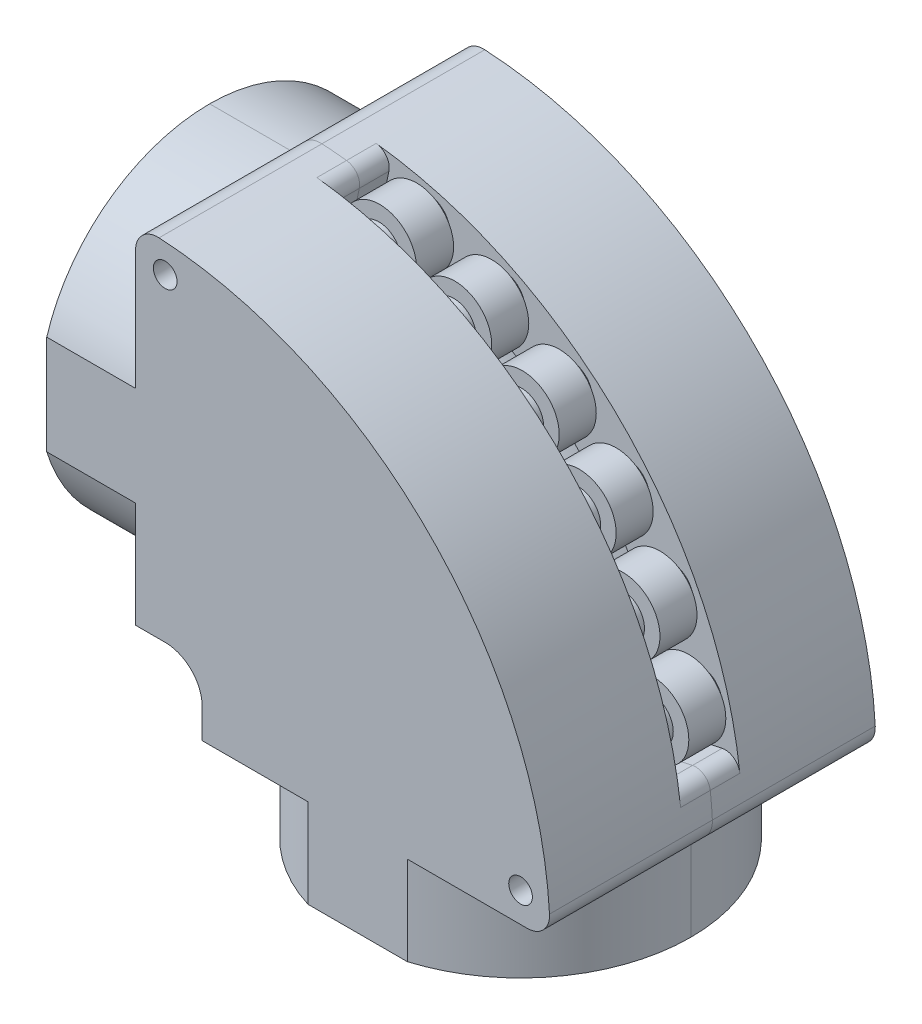
from build123d import *

# Parameters (mm, degrees)
EXTRUDE_1_DEPTH              = 11
SWEEP_1_PROFILE_R            = 9
SKETCH_20_W                  = 22
SKETCH_20_H                  = 26.000000000000004
SKETCH_20_R                  = 9.000000000000004
EXTRUDE_2_DEPTH              = 3
SKETCH_21_W                  = 26.000000000000004
SKETCH_21_H                  = 22
SKETCH_21_R                  = 9.000000000000004
EXTRUDE_3_DEPTH              = 3
SKETCH_22_R                  = 11.500000000000004
SKETCH_22_R_2                = 9.000000000000004
EXTRUDE_4_DEPTH              = 3
SKETCH_23_R                  = 11.500000000000005
SKETCH_23_R_2                = 9.000000000000004
EXTRUDE_5_DEPTH              = 3
SKETCH_25_R                  = 0.9900000000000011
SKETCH_25_R_2                = 0.9900000000000015
SKETCH_25_R_3                = 0.9899999999999978
SKETCH_25_R_4                = 0.9899999999999924
CUT_EXTRUDE_2_DEPTH          = 2
FILLET_1_R                   = 1
SKETCH_26_R                  = 1.5000000000000009
SKETCH_26_R_2                = 1.5000000000000007
EXTRUDE_6_DEPTH              = 0.7
EXTRUDE_7_DEPTH              = 11
CUT_EXTRUDE_3_DEPTH          = 6
SKETCH_24_R                  = 0.6999999999999982
SKETCH_24_R_2                = 0.699999999999998
SKETCH_24_R_3                = 0.7000000000000001
CUT_EXTRUDE_4_DEPTH          = 20.000000000000004
CUT_EXTRUDE_START            = -3
CUT_EXTRUDE_5_DEPTH          = 3
CUT_EXTRUDE_6_DEPTH          = 3
SKETCH_32_R                  = 10.04
CUT_EXTRUDE_7_DEPTH          = 4
SKETCH_33_R                  = 10.040000000000003
CUT_EXTRUDE_8_DEPTH          = 4
CUT_EXTRUDE_9_DEPTH          = 4
CUT_EXTRUDE_10_DEPTH         = 4
FILLET_2_R                   = 1.5
CHAMFER_1_SIZE               = 0.3
HOLE_START                   = -5
HOLE_WIZARD_M2_1_OUTLINE_R   = 0.8
HOLE_WIZARD_M2_1_OUTLINE_R_2 = 0.7
HOLE_WIZARD_M2_1_DEPTH       = 5
SKETCH_40_R                  = 1.0500000000000003
CUT_EXTRUDE_13_DEPTH         = 5
SKETCH_41_R                  = 2.4999999999999996
SKETCH_41_R_2                = 1
EXTRUDE_8_DEPTH              = 1.25
SKETCH_41_R_3                = 1.0000000000000018
EXTRUDE_8_2_DEPTH            = 1.25
SKETCH_41_R_4                = 2.4999999999999982
EXTRUDE_8_3_DEPTH            = 1.25
EXTRUDE_8_4_DEPTH            = 1.25
SKETCH_41_R_5                = 2.4999999999999987
EXTRUDE_8_5_DEPTH            = 1.25
SKETCH_41_R_6                = 1.0000000000000013
EXTRUDE_8_6_DEPTH            = 1.25
FILLET_5_R                   = 1.5
FILLET_6_R                   = 1.5
CHAMFER_2_SIZE               = 0.3
CHAMFER_3_SIZE               = 0.3


# Read off the part's stored shape, not the designer's step: M2 螺纹孔1
with BuildPart() as part:
    # 草图1 → 凸台-拉伸1 (new, symmetric)
    with BuildSketch(Plane.XY):
        with BuildLine():
            Line((0, 2), (0, 28))
            ThreePointArc((0, 28), (19.79898987322333, 19.798989873223327), (28, 0))
            Line((28, 0), (2, 0))
            ThreePointArc((2, 0), (1.4142135623730951, 1.414213562373095), (0, 2))
        make_face()
    extrude(amount=EXTRUDE_1_DEPTH, both=True)

    # 切除-扫描1: sweep along a path in 草图2
    with BuildLine(Plane.XY) as sweep_1_path:
        CenterArc((0, 0), 15, 0, 360)
    # 切除-扫描1 profile (on start of the path) → 切除-扫描1 (sweep, cut)
    with BuildSketch(Plane(origin=(15, 0, 0), x_dir=(0, 0, 1), z_dir=(0, 1, 0))):
        Circle(SWEEP_1_PROFILE_R)
    sweep(path=sweep_1_path.line, mode=Mode.SUBTRACT)

    # 草图20 → 凸台-拉伸2 (add)
    with BuildSketch(Plane.ZY):
        with Locations((0, 15.000000000000002)):
            Rectangle(SKETCH_20_W, SKETCH_20_H)
        with Locations(Location((0, 15, 0), (0, 0, 90))):
            Circle(SKETCH_20_R, mode=Mode.SUBTRACT)
    extrude(amount=EXTRUDE_2_DEPTH)

    # 草图21 → 凸台-拉伸3 (add)
    with BuildSketch(Plane.XZ):
        with Locations((15.000000000000002, 0)):
            Rectangle(SKETCH_21_W, SKETCH_21_H)
        with Locations((15, 0)):
            Circle(SKETCH_21_R, mode=Mode.SUBTRACT)
    extrude(amount=EXTRUDE_3_DEPTH)

    # 草图22 → 凸台-拉伸4 (add)
    with BuildSketch(Plane.ZY.offset(3)):
        with Locations(Location((0, 15, 0), (0, 0, 163.042573706))):
            Circle(SKETCH_22_R)
        with Locations(Location((0, 15, 0), (0, 0, 90))):
            Circle(SKETCH_22_R_2, mode=Mode.SUBTRACT)
    extrude(amount=EXTRUDE_4_DEPTH)

    # 草图23 → 凸台-拉伸5 (add)
    with BuildSketch(Plane.XZ.offset(3)):
        with Locations(Location((15, 0, 0), (0, 0, 73.042573706))):
            Circle(SKETCH_23_R)
        with Locations((15, 0)):
            Circle(SKETCH_23_R_2, mode=Mode.SUBTRACT)
    extrude(amount=EXTRUDE_5_DEPTH)


with BuildPart() as body_2:
    # Split Bodies 1: the piece on the far side of the plane
    add(part.part)
    split(bisect_by=Plane.XY, keep=Keep.BOTTOM)

    # 草图25 → 切除-拉伸2 (cut)
    with BuildSketch(Plane.XY):
        with BuildLine():
            Line((4.330809913065054, 27.663045484850322), (3.509435736738149, 23.742027310440555))
            Line((3.509435736738149, 23.742027310440555), (2.768666432993156, 20.205794997881245))
            Line((2.768666432993156, 20.205794997881245), (18.79288362531123, 2.4726900148164406))
            Line((18.79288362531123, 2.4726900148164406), (23.74202731044055, 3.50943573673818))
            Line((23.74202731044055, 3.50943573673818), (27.66304548485032, 4.3308099130650675))
            ThreePointArc((27.66304548485032, 4.3308099130650675), (19.798989873223327, 19.798989873223338), (4.330809913065054, 27.663045484850322))
        make_face()
        with Locations((20.20579499788125, 16.362330167295774)):
            Circle(SKETCH_25_R, mode=Mode.SUBTRACT)
        with Locations((23.166169628897574, 11.803752993228205)):
            Circle(SKETCH_25_R_2, mode=Mode.SUBTRACT)
        with Locations((25.114071483515783, 6.729295172665515)):
            Circle(SKETCH_25_R_2, mode=Mode.SUBTRACT)
        with Locations(Location((6.72929517266551, 25.11407148351578, 0), (0, 0, 180))):
            Circle(SKETCH_25_R, mode=Mode.SUBTRACT)
        with Locations(Location((11.803752993228201, 23.16616962889757, 0), (0, 0, 180))):
            Circle(SKETCH_25_R_3, mode=Mode.SUBTRACT)
        with Locations(Location((16.36233016729577, 20.205794997881245, 0), (0, 0, 180))):
            Circle(SKETCH_25_R_4, mode=Mode.SUBTRACT)
    extrude(amount=-CUT_EXTRUDE_2_DEPTH, mode=Mode.SUBTRACT)

    # 圆角1
    fillet_1_edges = [body_2.edges().sort_by_distance(p)[0] for p in [
        (23.68668897770624, 3.4978434728293823, -1.006332760110998),
        (3.497843472828735, 23.6866889777033, -1.0063327601106522),
        (27.663045484850322, 4.3308099130650675, -1),
        (4.330809913065055, 27.663045484850326, -1),
    ]]
    fillet(fillet_1_edges, radius=FILLET_1_R)

    # 草图26 → 凸台-拉伸6 (add)
    with BuildSketch(Plane.XY.offset(-2)):
        with Locations((6.72929517266551, 25.11407148351578)):
            Circle(SKETCH_26_R)
        with Locations((11.803752993228201, 23.16616962889757)):
            Circle(SKETCH_26_R)
        with Locations((16.36233016729577, 20.205794997881245)):
            Circle(SKETCH_26_R)
        with Locations((20.20579499788125, 16.362330167295774)):
            Circle(SKETCH_26_R)
        with Locations((23.166169628897574, 11.803752993228205)):
            Circle(SKETCH_26_R)
        with Locations((25.114071483515783, 6.729295172665515)):
            Circle(SKETCH_26_R_2)
    extrude(amount=EXTRUDE_6_DEPTH)

    # 草图27 → 凸台-拉伸7 (add)
    with BuildSketch(Plane.XY):
        with BuildLine():
            Line((0, 2), (0, 0))
            Line((0, 0), (2, 0))
            ThreePointArc((2, 0), (1.4142135623730951, 1.414213562373095), (0, 2))
        make_face()
    extrude(amount=-EXTRUDE_7_DEPTH)

    # 草图28 → 切除-拉伸3 (cut)
    with BuildSketch(Plane(origin=(0, 0, -11), x_dir=(-1, 0, 0), z_dir=(0, 0, -1))):
        with BuildLine():
            Line((-4.5, 1.9999999999999982), (-4.500000000000001, -3))
            Line((-4.500000000000001, -3), (3, -3))
            Line((3, -3), (3, 4.499999999999999))
            Line((3, 4.499999999999999), (-2.0000000000000004, 4.499999999999999))
            ThreePointArc((-2.0000000000000004, 4.499999999999999), (-3.767766952966369, 3.767766952966368), (-4.5, 1.9999999999999982))
        make_face()
    extrude(amount=-CUT_EXTRUDE_3_DEPTH, mode=Mode.SUBTRACT)

    # 草图24 → 切除-拉伸4 (cut)
    with BuildSketch(Plane.XY):
        with Locations((2, 26)):
            Circle(SKETCH_24_R)
        with Locations((25.999999999999996, 2.0000000000000018)):
            Circle(SKETCH_24_R_2)
        with Locations((2, 1.9999999999999987)):
            Circle(SKETCH_24_R_3)
    extrude(amount=-CUT_EXTRUDE_4_DEPTH, mode=Mode.SUBTRACT)

    # 草图30 → 切除-拉伸5 (cut)
    with BuildSketch(Plane.ZY.offset(3).offset(CUT_EXTRUDE_START)):
        with BuildLine():
            ThreePointArc((-11, 18.3541019662497), (-6.843896090244526, 24.2418118519009), (7e-16, 26.500000000000007))
            Line((7e-16, 26.500000000000004), (0, 28))
            Line((0, 28), (-11, 28))
            Line((-11, 28), (-10.999999999999998, 18.3541019662497))
        make_face()
        with BuildLine():
            ThreePointArc((8.9e-16, 3.4999999999999947), (-6.843896090244344, 5.758188148098972), (-10.99999999999987, 11.645898033749877))
            Line((-10.999999999999998, 11.645898033749859), (-11, 4.5))
            Line((-11, 4.499999999999999), (-4.999999999999999, 4.499999999999999))
            Line((-4.999999999999999, 4.499999999999999), (-4.999999999999999, 1.9999999999999982))
            Line((-4.999999999999999, 1.9999999999999982), (0, 2))
            Line((0, 2), (0, 3.4999999999999942))
        make_face()
        with BuildLine():
            Line((-10.999999999999998, 11.645898033749859), (-10.999999999999998, 18.3541019662497))
            ThreePointArc((-11, 18.3541019662497), (-11.500000000000004, 14.99999999999978), (-10.99999999999987, 11.645898033749877))
        make_face()
    extrude(amount=CUT_EXTRUDE_5_DEPTH, mode=Mode.SUBTRACT)

    # 草图31 → 切除-拉伸6 (cut)
    with BuildSketch(Plane.XZ.offset(3).offset(CUT_EXTRUDE_START)):
        with BuildLine():
            Line((28, -11), (28, 0))
            Line((28, 0), (26.500000000000004, 0))
            ThreePointArc((26.500000000000004, 0), (24.2418118519009, -6.843896090244522), (18.354101966249704, -11))
            Line((18.354101966249704, -11), (28, -11))
        make_face()
        with BuildLine():
            Line((4.500000000000001, -4.999999999999999), (4.500000000000001, -11))
            Line((4.500000000000001, -11), (11.645898033750294, -11))
            ThreePointArc((11.645898033750294, -11), (5.758188148099103, -6.84389609024452), (3.4999999999999942, 0))
            Line((3.4999999999999942, 0), (2, 0))
            Line((2, 0), (2.000000000000001, -4.999999999999999))
            Line((2.000000000000001, -4.999999999999999), (4.500000000000001, -4.999999999999999))
        make_face()
    extrude(amount=CUT_EXTRUDE_6_DEPTH, mode=Mode.SUBTRACT)

    # 草图32 → 切除-拉伸7 (cut)
    with BuildSketch(Plane.ZY.offset(6)):
        with Locations((0, 15)):
            Circle(SKETCH_32_R)
    extrude(amount=-CUT_EXTRUDE_7_DEPTH, mode=Mode.SUBTRACT)

    # 草图33 → 切除-拉伸8 (cut)
    with BuildSketch(Plane.XZ.offset(6)):
        with Locations((15, 0)):
            Circle(SKETCH_33_R)
    extrude(amount=-CUT_EXTRUDE_8_DEPTH, mode=Mode.SUBTRACT)

    # 草图34 → 切除-拉伸9 (cut)
    with BuildSketch(Plane(origin=(0, -3, 0), x_dir=(1, 0, 0), z_dir=(0, 1, 0))):
        with BuildLine():
            Line((11.645898033750296, 11), (18.354101966249704, 11))
            ThreePointArc((18.354101966249704, 11), (15, 11.500000000000005), (11.645898033750296, 11))
        make_face()
    extrude(amount=-CUT_EXTRUDE_9_DEPTH, mode=Mode.SUBTRACT)

    # 草图35 → 切除-拉伸10 (cut)
    with BuildSketch(Plane(origin=(-3, 0, 0), x_dir=(0, 0, -1), z_dir=(1, 0, 0))):
        with BuildLine():
            Line((10.999999999999998, 18.354101966249704), (10.999999999999996, 11.645898033750292))
            ThreePointArc((10.999999999999996, 11.645898033750292), (11.500000000000004, 14.999999999999998), (10.999999999999998, 18.354101966249704))
        make_face()
    extrude(amount=-CUT_EXTRUDE_10_DEPTH, mode=Mode.SUBTRACT)

    # 圆角2
    fillet_2_edges = [body_2.edges().sort_by_distance(p)[0] for p in [
        (0, 0, -2.5),
    ]]
    fillet(fillet_2_edges, radius=FILLET_2_R)

    # 倒角1
    chamfer_1_edges = [body_2.edges().sort_by_distance(p)[0] for p in [
        (-6, 15.000000000000002, -10.04),
    ]]
    chamfer(chamfer_1_edges, length=CHAMFER_1_SIZE)

    # M2 螺纹孔1 outline → M2 螺纹孔1 (cut)
    with BuildSketch(Plane.XY.offset(HOLE_START)):
        with Locations((2, 2)):
            Circle(HOLE_WIZARD_M2_1_OUTLINE_R)
        with Locations((2, 2)):
            Circle(HOLE_WIZARD_M2_1_OUTLINE_R_2, mode=Mode.SUBTRACT)
    extrude(amount=HOLE_WIZARD_M2_1_DEPTH, mode=Mode.SUBTRACT)

    # Hole Wizard M2 _1 2 outline → Hole Wizard M2 _1 2 (revolve, cut)
    with BuildSketch(Plane(origin=(26, 2, 0), x_dir=(1, 0, 0), z_dir=(0, -1, 0))):
        Polygon((0.8, -3), (0.7, -2.939913938), (0.7, -11), (0.8, -11), align=None)
    revolve(axis=Axis((26, 2, 0), (0, 0, 1)), mode=Mode.SUBTRACT)

    # Hole Wizard M2 _1 3 outline → Hole Wizard M2 _1 3 (revolve, cut)
    with BuildSketch(Plane(origin=(2, 26, 0), x_dir=(1, 0, 0), z_dir=(0, -1, 0))):
        Polygon((0.8, -3), (0.7, -2.939913938), (0.7, -11), (0.8, -11), align=None)
    revolve(axis=Axis((2, 26, 0), (0, 0, 1)), mode=Mode.SUBTRACT)


with BuildPart() as part_1:
    add(part.part)

    # Split Bodies 1
    split(bisect_by=Plane.XY, keep=Keep.TOP)


with BuildPart() as body_3:
    # 镜向2: mirrored copy
    add(body_2.part.mirror(Plane.XY))

    # 草图40 → 切除-拉伸13 (cut)
    with BuildSketch(Plane.XY.offset(4.999999999999999)):
        with Locations((2, 1.9999999999999987)):
            Circle(SKETCH_40_R)
    extrude(amount=-CUT_EXTRUDE_13_DEPTH, mode=Mode.SUBTRACT)

    # 圆角6
    fillet_6_edges = [body_3.edges().sort_by_distance(p)[0] for p in [
        (0, 28, 5.5),
        (28, -4.8e-16, 5.5),
    ]]
    fillet(fillet_6_edges, radius=FILLET_6_R)

    # 倒角2
    chamfer_2_edges = [body_3.edges().sort_by_distance(p)[0] for p in [
        (14.999999999999998, -6, 10.040000000000003),
    ]]
    chamfer(chamfer_2_edges, length=CHAMFER_2_SIZE)


with BuildPart() as body_4:
    # 草图41 → 凸台-拉伸8 (new, symmetric)
    with BuildSketch(Plane.XY):
        with Locations((6.72929517266551, 25.11407148351578)):
            Circle(SKETCH_41_R)
        with Locations((6.72929517266551, 25.11407148351578)):
            Circle(SKETCH_41_R_2, mode=Mode.SUBTRACT)
    extrude(amount=EXTRUDE_8_DEPTH, both=True)


with BuildPart() as body_5:
    # 草图41 → Extrude 8 2 (new, symmetric)
    with BuildSketch(Plane.XY):
        with Locations((11.803752993228201, 23.16616962889757)):
            Circle(SKETCH_41_R)
        with Locations((11.803752993228201, 23.16616962889757)):
            Circle(SKETCH_41_R_3, mode=Mode.SUBTRACT)
    extrude(amount=EXTRUDE_8_2_DEPTH, both=True)


with BuildPart() as body_6:
    # 草图41 → Extrude 8 3 (new, symmetric)
    with BuildSketch(Plane.XY):
        with Locations((16.36233016729577, 20.205794997881245)):
            Circle(SKETCH_41_R_4)
        with Locations((16.36233016729577, 20.205794997881245)):
            Circle(SKETCH_41_R_3, mode=Mode.SUBTRACT)
    extrude(amount=EXTRUDE_8_3_DEPTH, both=True)


with BuildPart() as body_7:
    # 草图41 → Extrude 8 4 (new, symmetric)
    with BuildSketch(Plane.XY):
        with Locations((20.20579499788125, 16.362330167295774)):
            Circle(SKETCH_41_R_4)
        with Locations((20.20579499788125, 16.362330167295774)):
            Circle(SKETCH_41_R_3, mode=Mode.SUBTRACT)
    extrude(amount=EXTRUDE_8_4_DEPTH, both=True)


with BuildPart() as body_8:
    # 草图41 → Extrude 8 5 (new, symmetric)
    with BuildSketch(Plane.XY):
        with Locations((23.166169628897574, 11.803752993228205)):
            Circle(SKETCH_41_R_5)
        with Locations((23.166169628897574, 11.803752993228205)):
            Circle(SKETCH_41_R_3, mode=Mode.SUBTRACT)
    extrude(amount=EXTRUDE_8_5_DEPTH, both=True)


with BuildPart() as body_9:
    # 草图41 → Extrude 8 6 (new, symmetric)
    with BuildSketch(Plane.XY):
        with Locations((25.114071483515783, 6.729295172665515)):
            Circle(SKETCH_41_R_4)
        with Locations((25.114071483515783, 6.729295172665515)):
            Circle(SKETCH_41_R_6, mode=Mode.SUBTRACT)
    extrude(amount=EXTRUDE_8_6_DEPTH, both=True)


with BuildPart() as body_2_1:
    add(body_2.part)

    # 圆角5
    fillet_5_edges = [body_2_1.edges().sort_by_distance(p)[0] for p in [
        (28, -4.8e-16, -5.5),
        (0, 28, -5.5),
    ]]
    fillet(fillet_5_edges, radius=FILLET_5_R)

    # 倒角3
    chamfer_3_edges = [body_2_1.edges().sort_by_distance(p)[0] for p in [
        (14.999999999999998, -6, -10.040000000000003),
    ]]
    chamfer(chamfer_3_edges, length=CHAMFER_3_SIZE)


solid = Compound([body_3.part, body_4.part, body_5.part, body_6.part, body_7.part, body_8.part, body_9.part, body_2_1.part])
